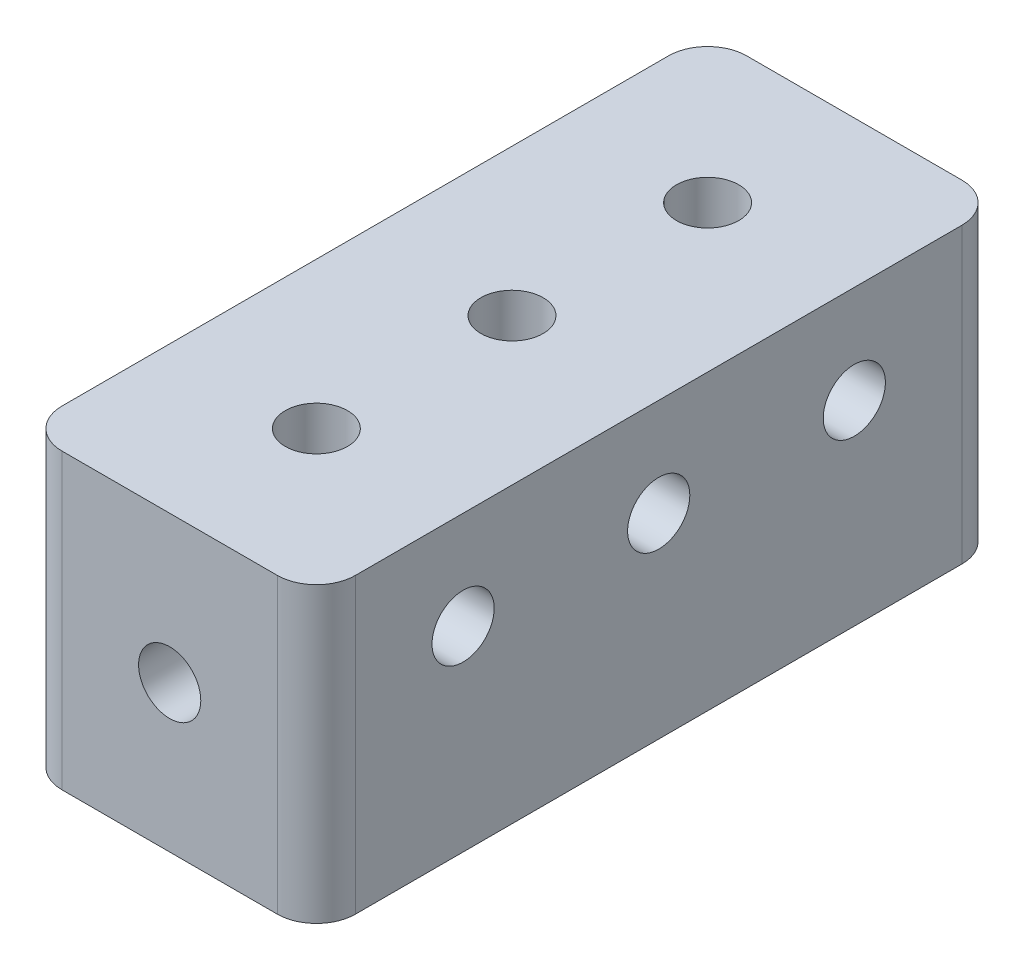
from build123d import *

# Parameters (mm, degrees)
SKETCH1_W           = 19.05
SKETCH1_H           = 44.45
BOSS_EXTRUDE1_DEPTH = 9.525
SKETCH2_R           = 2.0193
CUT_EXTRUDE1_DEPTH  = 9.525
SKETCH3_R           = 2.0193
CUT_EXTRUDE2_DEPTH  = 47.446245812
SKETCH4_R           = 2.0193
CUT_EXTRUDE3_DEPTH  = 6.35
CUT_EXTRUDE4_START  = -6.35
SKETCH5_R           = 2.0193
CUT_EXTRUDE4_DEPTH  = 6.35
SKETCH6_R           = 2.0193
CUT_EXTRUDE5_DEPTH  = 6.35
FILLET1_R           = 2.54


with BuildPart() as part:
    # Sketch1 → Boss-Extrude1 (new, symmetric)
    with BuildSketch(Plane(origin=(0, 0, 0), x_dir=(1, 0, 0), z_dir=(0, 1, 0))):
        Rectangle(SKETCH1_W, SKETCH1_H)
    extrude(amount=BOSS_EXTRUDE1_DEPTH, both=True)

    # Sketch2 → Cut-Extrude1 (cut)
    with BuildSketch(Plane.XY.offset(22.225)):
        Circle(SKETCH2_R)
    extrude(amount=-CUT_EXTRUDE1_DEPTH, mode=Mode.SUBTRACT)

    # Sketch3 → Cut-Extrude2 (cut, through all)
    with BuildSketch(Plane(origin=(0, 0, -22.225), x_dir=(-1, 0, 0), z_dir=(0, 0, -1))):
        Circle(SKETCH3_R)
    extrude(amount=-CUT_EXTRUDE2_DEPTH, mode=Mode.SUBTRACT)

    # Sketch4 → Cut-Extrude3 (cut)
    with BuildSketch(Plane(origin=(9.525, 0, 0), x_dir=(0, 0, -1), z_dir=(1, 0, 0))):
        with Locations((-12.7, 3.175)):
            Circle(SKETCH4_R)
        with Locations((12.7, 3.175)):
            Circle(SKETCH4_R)
        with Locations((0, 3.175)):
            Circle(SKETCH4_R)
    extrude(amount=-CUT_EXTRUDE3_DEPTH, mode=Mode.SUBTRACT)

    # Sketch5 → Cut-Extrude4 (cut)
    with BuildSketch(Plane.ZY.offset(9.525).offset(CUT_EXTRUDE4_START)):
        with Locations((-12.7, 3.175)):
            Circle(SKETCH5_R)
        with Locations((0, 3.175)):
            Circle(SKETCH5_R)
        with Locations((12.7, 3.175)):
            Circle(SKETCH5_R)
    extrude(amount=CUT_EXTRUDE4_DEPTH, mode=Mode.SUBTRACT)

    # Sketch6 → Cut-Extrude5 (cut)
    with BuildSketch(Plane(origin=(0, 9.525, 0), x_dir=(1, 0, 0), z_dir=(0, 1, 0))):
        with Locations((0, 12.7)):
            Circle(SKETCH6_R)
        Circle(SKETCH6_R)
        with Locations((0, -12.7)):
            Circle(SKETCH6_R)
    extrude(amount=-CUT_EXTRUDE5_DEPTH, mode=Mode.SUBTRACT)

    # Fillet1
    fillet1_edges = [part.edges().sort_by_distance(p)[0] for p in [
        (9.525, 0, 22.225),
        (-9.525, 0, 22.225),
        (-9.525, 0, -22.225),
        (9.525, 0, -22.225),
    ]]
    fillet(fillet1_edges, radius=FILLET1_R)


solid = part.part
